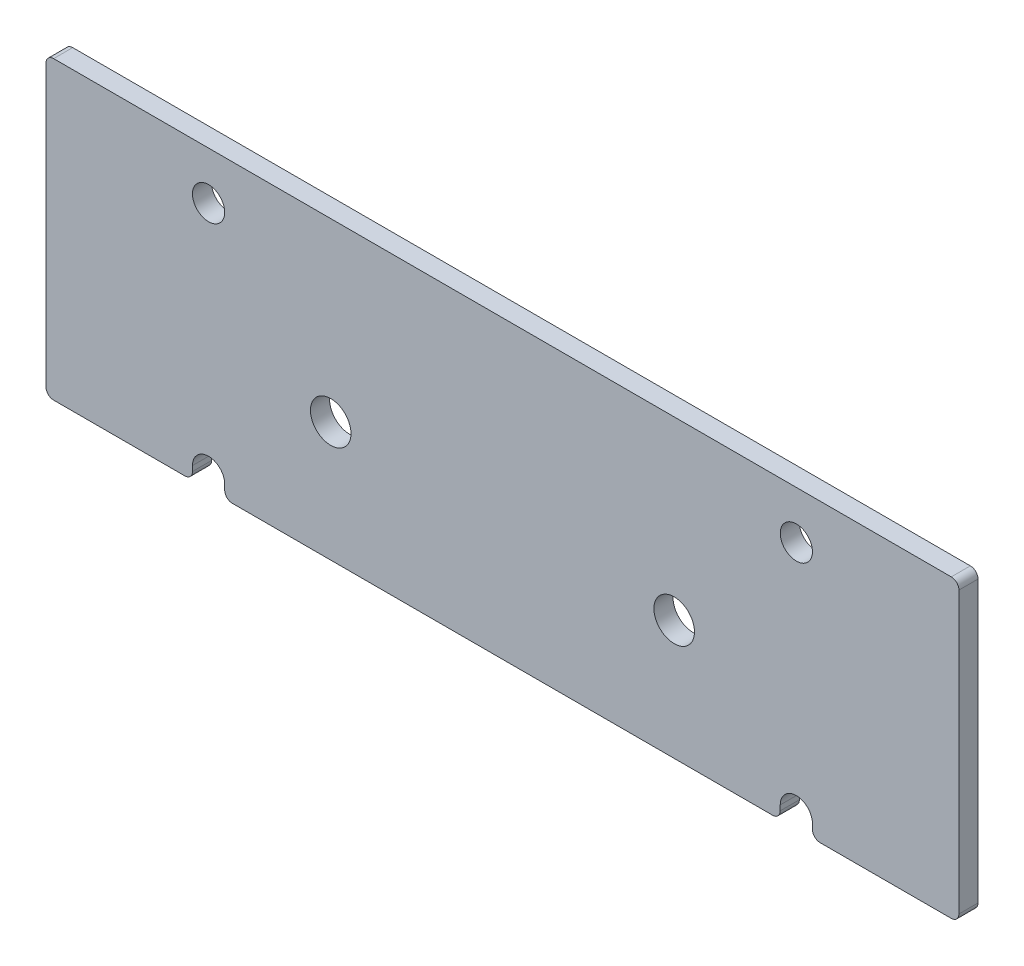
from build123d import *

# Parameters (mm, degrees)
BOSS_EXTRUDE1_DEPTH              = 6.35
CUT_EXTRUDE3_DEPTH               = 221.472033966
F_27_64_0_42188_DIAMETER_HOLE1_D = 10.715752
FILLET1_R                        = 2.54
F_1_2_CLEARANCE_HOLE1_D          = 13.49248
SKETCH7_W                        = 303.784
SKETCH7_H                        = 55.43328257
CUT_EXTRUDE1_DEPTH               = 200.030230178
CUT_EXTRUDE2_DEPTH               = 200.030230178
FILLET2_R                        = 2.54


with BuildPart() as part:
    # Sketch1 → Boss-Extrude1 (new body)
    with BuildSketch(Plane.XY):
        with BuildLine():
            Line((-179.07, -25.4), (-179.07, 128.45828257))
            Line((-179.07, 128.45828257), (179.07, 128.45828257))
            Line((179.07, 128.45828257), (179.07, -25.4))
            Line((179.07, -25.4), (153.67, -25.4))
            Line((153.67, -25.4), (153.67, -1.27))
            ThreePointArc((153.67, -1.27), (127, 25.4), (100.33, -1.27))
            Line((100.33, -1.27), (100.33, -25.4))
            Line((100.33, -25.4), (-100.33, -25.4))
            Line((-100.33, -25.4), (-100.33, -1.27))
            ThreePointArc((-100.33, -1.27), (-127, 25.4), (-153.67, -1.27))
            Line((-153.67, -1.27), (-153.67, -25.4))
            Line((-153.67, -25.4), (-179.07, -25.4))
        make_face()
    extrude(amount=BOSS_EXTRUDE1_DEPTH)

    # Sketch9 → Cut-Extrude3 (cut, through all)
    with BuildSketch(Plane.XY.offset(6.35)):
        with BuildLine():
            Line((-151.892, 128.45828257), (-151.892, 8.304823027))
            ThreePointArc((-151.892, 8.304823027), (-153.22173278, 3.599253536), (-153.67, -1.27))
            Line((-153.67, -1.27), (-153.67, -25.4))
            Line((-153.67, -25.4), (-179.07, -25.4))
            Line((-179.07, -25.4), (-179.07, 128.45828257))
            Line((-179.07, 128.45828257), (-151.892, 128.45828257))
        make_face()
        with BuildLine():
            Line((153.67, -25.4), (153.67, -1.27))
            ThreePointArc((153.67, -1.27), (153.22173278, 3.599253536), (151.892, 8.304823027))
            Line((151.892, 8.304823027), (151.892, 128.45828257))
            Line((151.892, 128.45828257), (179.07, 128.45828257))
            Line((179.07, 128.45828257), (179.07, -25.4))
            Line((179.07, -25.4), (153.67, -25.4))
        make_face()
    extrude(amount=-CUT_EXTRUDE3_DEPTH, mode=Mode.SUBTRACT)

    # 27/64 (0.42188) Diameter Hole1 (through all)
    with Locations(Plane.XY.offset(6.35)):
        with Locations((-97.79, 34.29), (-97.79, 112.58328257), (97.79, 34.29), (97.79, 112.58328257)):
            Hole(F_27_64_0_42188_DIAMETER_HOLE1_D / 2)

    # Fillet1
    fillet1_edges = [part.edges().sort_by_distance(p)[0] for p in [
        (100.33, -25.4, 3.175),
        (-100.33, -25.4, 3.175),
        (151.892, 8.304823027, 3.175),
        (151.892, 128.45828257, 3.175),
        (-151.892, 128.45828257, 3.175),
        (-151.892, 8.304823027, 3.175),
    ]]
    fillet(fillet1_edges, radius=FILLET1_R)

    # 1/2 Clearance Hole1 (through all)
    with Locations(Plane.XY.offset(6.35)):
        with Locations((57.15, 69.85), (-57.15, 69.85)):
            Hole(F_1_2_CLEARANCE_HOLE1_D / 2)

    # Sketch7 → Cut-Extrude1 (cut, through all)
    with BuildSketch(Plane.XY.offset(6.35)):
        with Locations((0, 2.316641285)):
            Rectangle(SKETCH7_W, SKETCH7_H)
    extrude(amount=-CUT_EXTRUDE1_DEPTH, mode=Mode.SUBTRACT)

    # Sketch8 → Cut-Extrude2 (cut, through all)
    with BuildSketch(Plane.XY.offset(6.35)):
        Polygon((-94.536203455, 30.03328257), (-92.432124, 30.03328257), (-92.432124, 34.29), align=None)
        Polygon((-103.147876, 34.29), (-103.147876, 30.03328257), (-101.043796545, 30.03328257), align=None)
        Polygon((101.043796545, 30.03328257), (103.147876, 30.03328257), (103.147876, 34.29), align=None)
        Polygon((92.432124, 34.29), (92.432124, 30.03328257), (94.536203455, 30.03328257), align=None)
    extrude(amount=-CUT_EXTRUDE2_DEPTH, mode=Mode.SUBTRACT)

    # Fillet2
    fillet2_edges = [part.edges().sort_by_distance(p)[0] for p in [
        (-103.147876, 30.03328257, 3.175),
        (-92.432124, 30.03328257, 3.175),
        (92.432124, 30.03328257, 3.175),
        (103.147876, 30.03328257, 3.175),
        (151.892, 30.03328257, 3.175),
        (-151.892, 30.03328257, 3.175),
    ]]
    fillet(fillet2_edges, radius=FILLET2_R)


solid = part.part
